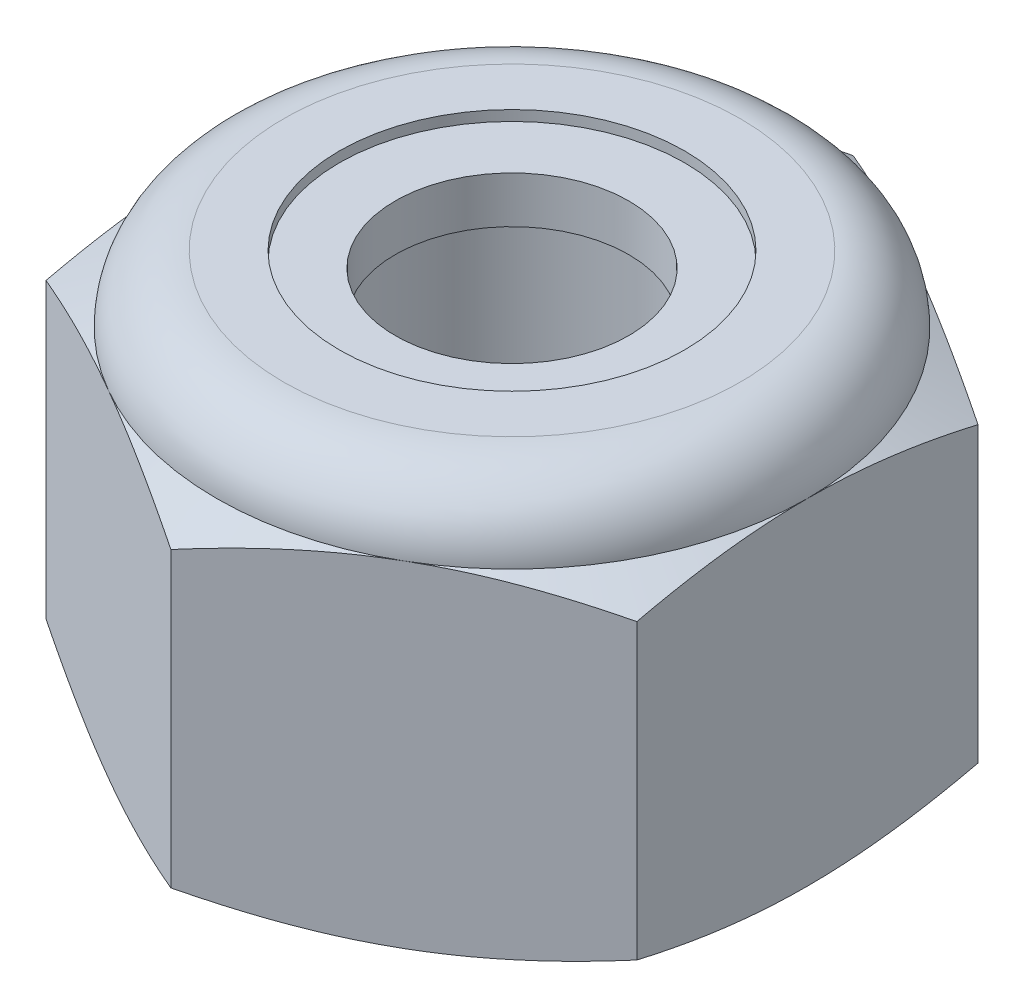
from build123d import *

# Parameters (mm, degrees)
EXTRUDE1_DEPTH = 5.953125
SKETCH2_W      = 2.0828
SKETCH2_H      = 5.953125


with BuildPart() as part:
    # Sketch1 → Extrude1 (new body)
    with BuildSketch(Plane(origin=(0, 0, 0), x_dir=(1, 0, 0), z_dir=(0, 1, 0))):
        Polygon((0, 5.040989538), (-4.365625, 2.520494769), (-4.365625, -2.520494769), (0, -5.040989538), (4.365625, -2.520494769), (4.365625, 2.520494769), align=None)
    extrude(amount=EXTRUDE1_DEPTH)

    # Sketch4 → Cut-Revolve2 (revolve, cut)
    with BuildSketch(Plane(origin=(0, 0, 0), x_dir=(0, 0, -1), z_dir=(1, 0, 0))):
        Polygon((0, 5.953125), (2.0828, 5.953125), (1.725765218, 5.786636947), (1.725765218, 0.166488053), (2.0828, 0), (0, 0), align=None)
    revolve(axis=Axis((0, 5.953125, 0), (0, 1, 0)), mode=Mode.SUBTRACT)


with BuildPart() as body_2:
    # Sketch2 → Revolve1 (revolve)
    with BuildSketch(Plane(origin=(0, 0, 0), x_dir=(0, 0, -1), z_dir=(1, 0, 0))):
        with Locations((1.0414, 2.9765625)):
            Rectangle(SKETCH2_W, SKETCH2_H)
    revolve(axis=Axis((0, -2.0828, 0), (0, 1, 0)))


with BuildPart() as part_1:
    add(part.part)

    # Combine1: cut body 2
    add(body_2.part, mode=Mode.SUBTRACT)

    # Sketch5 → Cut-Revolve3 (revolve, cut)
    with BuildSketch(Plane(origin=(0, 0, 0), x_dir=(0, 0, -1), z_dir=(1, 0, 0))):
        with BuildLine():
            Line((0, 0), (4.365625, 0))
            Line((4.365625, 0), (5.040989538, 0.314927656))
            Line((5.040989538, 0.314927656), (5.040989538, 4.646009844))
            Line((5.040989538, 4.646009844), (4.365625, 4.9609375))
            ThreePointArc((4.365625, 4.9609375), (4.075020009, 5.662520009), (3.3734375, 5.953125))
            Line((3.3734375, 5.953125), (3.3734375, 7.223125))
            Line((3.3734375, 7.223125), (6.310989538, 7.223125))
            Line((6.310989538, 7.223125), (6.310989538, -1.27))
            Line((6.310989538, -1.27), (0, -1.27))
            Line((0, -1.27), (0, 0))
        make_face()
    revolve(axis=Axis((0, 0, 0), (0, 1, 0)), mode=Mode.SUBTRACT)

    # Sketch6 → Cut-Revolve4 (revolve, cut)
    with BuildSketch(Plane(origin=(0, 0, 0), x_dir=(0, 0, -1), z_dir=(1, 0, 0))):
        with BuildLine():
            Line((0, 4.9609375), (4.213225, 4.9609375))
            ThreePointArc((4.213225, 4.9609375), (3.967256936, 5.554756936), (3.3734375, 5.800725))
            Line((3.3734375, 5.800725), (2.549601359, 5.800725))
            Line((2.549601359, 5.800725), (2.549601359, 7.223125))
            Line((2.549601359, 7.223125), (0, 7.223125))
            Line((0, 7.223125), (0, 4.9609375))
        make_face()
    revolve(axis=Axis((0, 7.223125, 0), (0, 1, 0)), mode=Mode.SUBTRACT)


with BuildPart() as body_2_2:
    # Sketch7 → Revolve2 (revolve)
    with BuildSketch(Plane(origin=(0, 0, 0), x_dir=(0, 0, -1), z_dir=(1, 0, 0))):
        with BuildLine():
            Line((1.725765218, 5.0371375), (4.133213408, 5.0371375))
            ThreePointArc((4.133213408, 5.0371375), (3.885726726, 5.527175629), (3.3734375, 5.724525))
            Line((3.3734375, 5.724525), (1.725765218, 5.724525))
            Line((1.725765218, 5.724525), (1.725765218, 5.0371375))
        make_face()
    revolve(axis=Axis((0, 5.0371375, 0), (0, 1, 0)))


solid = Compound([part_1.part, body_2_2.part])
